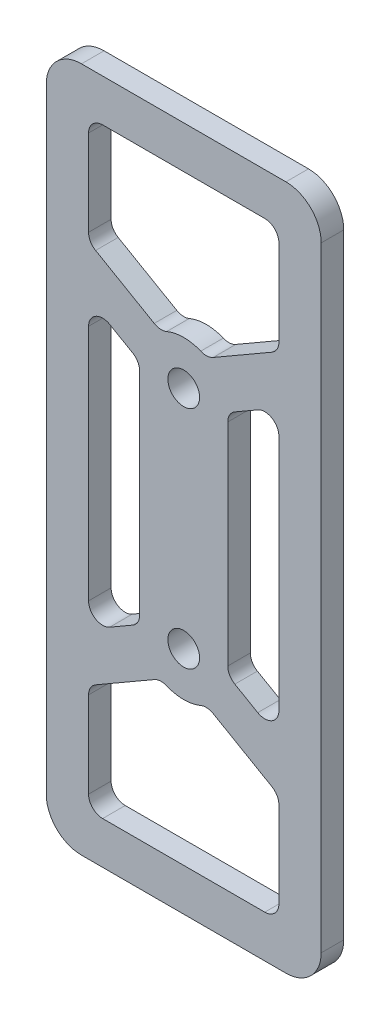
from build123d import *

# Parameters (mm, degrees)
STOCK_SPINE_MASTER_1_START     = -18.2
STOCK_SPINE_MASTER_1_OUTLINE_W = 39
STOCK_SPINE_MASTER_1_OUTLINE_H = 97.215728753
STOCK_SPINE_MASTER_1_OUTLINE_R = 2.25
STOCK_SPINE_MASTER_1_DEPTH     = 3.2
FILLET2_R                      = 5
CUT_EXTRUDE1_DEPTH             = 174.131424069
FILLET5_R                      = 2


# Read off the part's stored shape, not the designer's step: Stock-spine_master-1
with BuildPart() as part:
    # Stock-spine_master-1 outline → Stock-spine_master-1 (new body)
    with BuildSketch(Plane.XY.offset(STOCK_SPINE_MASTER_1_START)):
        with Locations((0, -123.392135623)):
            Rectangle(STOCK_SPINE_MASTER_1_OUTLINE_W, STOCK_SPINE_MASTER_1_OUTLINE_H)
        with Locations((0, -139.392135624)):
            Circle(STOCK_SPINE_MASTER_1_OUTLINE_R, mode=Mode.SUBTRACT)
        with Locations((0, -107.392135624)):
            Circle(STOCK_SPINE_MASTER_1_OUTLINE_R, mode=Mode.SUBTRACT)
    extrude(amount=STOCK_SPINE_MASTER_1_DEPTH)

    # Fillet2
    fillet2_edges = [part.edges().sort_by_distance(p)[0] for p in [
        (19.5, -172, -16.6),
        (19.5, -74.784271247, -16.6),
        (-19.5, -74.784271247, -16.6),
        (-19.5, -172, -16.6),
    ]]
    fillet(fillet2_edges, radius=FILLET2_R)

    # Sketch1 → Cut-Extrude1 (cut, through all)
    with BuildSketch(Plane.XY.offset(-15)):
        with BuildLine():
            Line((-6.248354978, -107.24874781), (-13.5, -103.062008605))
            Line((-13.5, -103.062008605), (-13.5, -143.722262643))
            Line((-13.5, -143.722262643), (-6.248354978, -139.535523437))
            ThreePointArc((-6.248354978, -139.535523437), (-6.249588731, -139.463834249), (-6.25, -139.392135624))
            Line((-6.25, -139.392135624), (-6.25, -107.392135624))
            ThreePointArc((-6.25, -107.392135624), (-6.249588731, -107.320436999), (-6.248354978, -107.24874781))
        make_face()
        with BuildLine():
            Line((13.5, -80.784271247), (-13.5, -80.784271247))
            Line((-13.5, -80.784271247), (-13.5, -96.133805375))
            Line((-13.5, -96.133805375), (-3.248354978, -102.052595387))
            ThreePointArc((-3.248354978, -102.052595387), (0, -101.142135624), (3.248354978, -102.052595387))
            Line((3.248354978, -102.052595387), (13.5, -96.133805375))
            Line((13.5, -96.133805375), (13.5, -80.784271247))
        make_face()
        with BuildLine():
            Line((13.5, -143.722262643), (13.5, -103.062008605))
            Line((13.5, -103.062008605), (6.248354978, -107.24874781))
            ThreePointArc((6.248354978, -107.24874781), (6.249588731, -107.320436999), (6.25, -107.392135624))
            Line((6.25, -107.392135624), (6.25, -139.392135624))
            ThreePointArc((6.25, -139.392135624), (6.249588731, -139.463834249), (6.248354978, -139.535523437))
            Line((6.248354978, -139.535523437), (13.5, -143.722262643))
        make_face()
        with BuildLine():
            Line((-3.248354978, -144.73167586), (-13.5, -150.650465873))
            Line((-13.5, -150.650465873), (-13.5, -166))
            Line((-13.5, -166), (13.5, -166))
            Line((13.5, -166), (13.5, -150.650465873))
            Line((13.5, -150.650465873), (3.248354978, -144.73167586))
            ThreePointArc((3.248354978, -144.73167586), (0, -145.642135624), (-3.248354978, -144.73167586))
        make_face()
    extrude(amount=-CUT_EXTRUDE1_DEPTH, mode=Mode.SUBTRACT)

    # Fillet5
    # the kernel refuses this fillet: 2 mm, written as the material it adds along each edge
    with BuildSketch(Plane(origin=(-6.248354978, -107.24874781, -15), x_dir=(-0.8660254037844632, 0.4999999999999575, 0), z_dir=(0, 0, -1)), Plane(origin=(6.248354978, -139.535523437, -15), x_dir=(0.8660254037844526, -0.4999999999999759, 0), z_dir=(0, 0, -1))) as fillet5_piece_1:
        with BuildLine():
            CenterArc((1.156600046, -2), FILLET5_R, 90, 60)
            Line((-0.575450762, -1), (-0.748655843, -0.9))
            ThreePointArc((-0.748655843, -0.9), (-0.243474357, -0.025), (-0.175453698, 0.096))
            Line((-0.175453698, 0.096), (0, 0.2))
            Line((0, 0.2), (1.156600046, 0.2))
            Line((1.156600046, 0.2), (1.156600046, 0))
        make_face()
    extrude(amount=3.2)
    with BuildSketch(Plane(origin=(6.248354978, -107.24874781, -15), x_dir=(0.8660254037844632, 0.4999999999999575, 0), z_dir=(0, 0, -1)), Plane(origin=(-6.248354978, -139.535523437, -15), x_dir=(-0.8660254037844523, -0.4999999999999766, 0), z_dir=(0, 0, -1))) as fillet5_piece_2:
        with BuildLine():
            CenterArc((1.156600046, 2), FILLET5_R, 210, 60)
            Line((-0.575450762, 1), (-0.748655843, 0.9))
            ThreePointArc((-0.748655843, 0.9), (-0.243474357, 0.025), (-0.175453698, -0.096))
            Line((-0.175453698, -0.096), (0, -0.2))
            Line((0, -0.2), (1.156600046, -0.2))
            Line((1.156600046, -0.2), (1.156600046, 0))
        make_face()
    extrude(amount=3.2)
    with BuildSketch(Plane(origin=(-13.5, -166, -15), x_dir=(0, 1, 0), z_dir=(0, 0, -1)), Plane(origin=(13.5, -166, -15), x_dir=(-1, 0, 0), z_dir=(0, 0, -1)), Plane(origin=(-13.5, -80.784271247, -15), x_dir=(1, 0, 0), z_dir=(0, 0, -1))) as fillet5_piece_3:
        with BuildLine():
            CenterArc((FILLET5_R, FILLET5_R), FILLET5_R, 180, 90)
            Line((0, FILLET5_R), (0, 0))
            Line((0, 0), (FILLET5_R, 0))
        make_face()
    extrude(amount=3.2)
    with BuildSketch(Plane(origin=(13.5, -150.650465873, -15), x_dir=(0, -1, 0), z_dir=(0, 0, -1)), Plane(origin=(13.5, -96.133805375, -15), x_dir=(-0.8660254037844395, -0.49999999999999867, 0), z_dir=(0, 0, -1)), Plane(origin=(-13.5, -96.133805375, -15), x_dir=(0, 1, 0), z_dir=(0, 0, -1)), Plane(origin=(-13.5, -150.650465873, -15), x_dir=(0.8660254037844375, 0.5000000000000019, 0), z_dir=(0, 0, -1))) as fillet5_piece_4:
        with BuildLine():
            CenterArc((FILLET5_R * 0.57735026919, FILLET5_R), FILLET5_R, 210, 60)
            Line((-FILLET5_R * 0.288675134595, FILLET5_R * 0.5), (0, 0))
            Line((0, 0), (FILLET5_R * 0.57735026919, 0))
        make_face()
    extrude(amount=3.2)
    with BuildSketch(Plane(origin=(13.5, -143.722262643, -15), x_dir=(-0.8660254037844394, 0.4999999999999986, 0), z_dir=(0, 0, -1)), Plane(origin=(13.5, -103.062008605, -15), x_dir=(0, -1, 0), z_dir=(0, 0, -1)), Plane(origin=(-13.5, -103.062008605, -15), x_dir=(0.866025403784438, -0.500000000000001, 0), z_dir=(0, 0, -1)), Plane(origin=(-13.5, -143.722262643, -15), x_dir=(0, 1, 0), z_dir=(0, 0, -1))) as fillet5_piece_5:
        with BuildLine():
            CenterArc((FILLET5_R * 1.73205080757, FILLET5_R), FILLET5_R, 150, 120)
            Line((FILLET5_R * 0.866025403784, FILLET5_R * 1.5), (0, 0))
            Line((0, 0), (FILLET5_R * 1.73205080757, 0))
        make_face()
    extrude(amount=3.2)
    with BuildSketch(Plane(origin=(13.5, -80.784271247, -15), x_dir=(-1, 0, 0), z_dir=(0, 0, -1))) as fillet5_piece_6:
        with BuildLine():
            CenterArc((FILLET5_R, -FILLET5_R), FILLET5_R, 90, 90)
            Line((0, -FILLET5_R), (0, 0))
            Line((0, 0), (FILLET5_R, 0))
        make_face()
    extrude(amount=3.2)
    with BuildSketch(Plane(origin=(3.248354978, -144.73167586, -15), x_dir=(0.866025403784452, -0.49999999999997674, 0), z_dir=(0, 0, -1)), Plane(origin=(-3.248354978, -102.052595387, -15), x_dir=(-0.8660254037844742, 0.4999999999999385, 0), z_dir=(0, 0, -1))) as fillet5_piece_7:
        with BuildLine():
            CenterArc((1.079274324, 2), FILLET5_R, 217.305200966, 52.694799034)
            ThreePointArc((-0.511562615, 0.787878788), (-0.240957875, 0.403564115), (0, 0))
            Line((0, 0), (1.079274324, 0))
        make_face()
    extrude(amount=3.2)
    with BuildSketch(Plane(origin=(-3.248354978, -144.73167586, -15), x_dir=(-0.8660254037844329, -0.5000000000000099, 0), z_dir=(0, 0, -1))) as fillet5_piece_8:
        with BuildLine():
            CenterArc((1.079274324, -2), FILLET5_R, 90, 52.694799034)
            ThreePointArc((-0.511562615, -0.787878788), (-0.240957875, -0.403564115), (0, 0))
            Line((0, 0), (1.079274324, 0))
        make_face()
    extrude(amount=3.2)
    with BuildSketch(Plane(origin=(3.248354978, -102.052595387, -15), x_dir=(-0.8909692919420457, 0.4540635647310734, 0), z_dir=(0, 0, -1))) as fillet5_piece_9:
        with BuildLine():
            CenterArc((1.089689758, 1.994344328), FILLET5_R, 212.99530149, 52.694799034)
            Line((-0.587740698, 0.905203811), (0, 0))
            ThreePointArc((0, 0), (0.469693861, 0.017673975), (0.939387723, 0))
        make_face()
    extrude(amount=3.2)


solid = part.part
